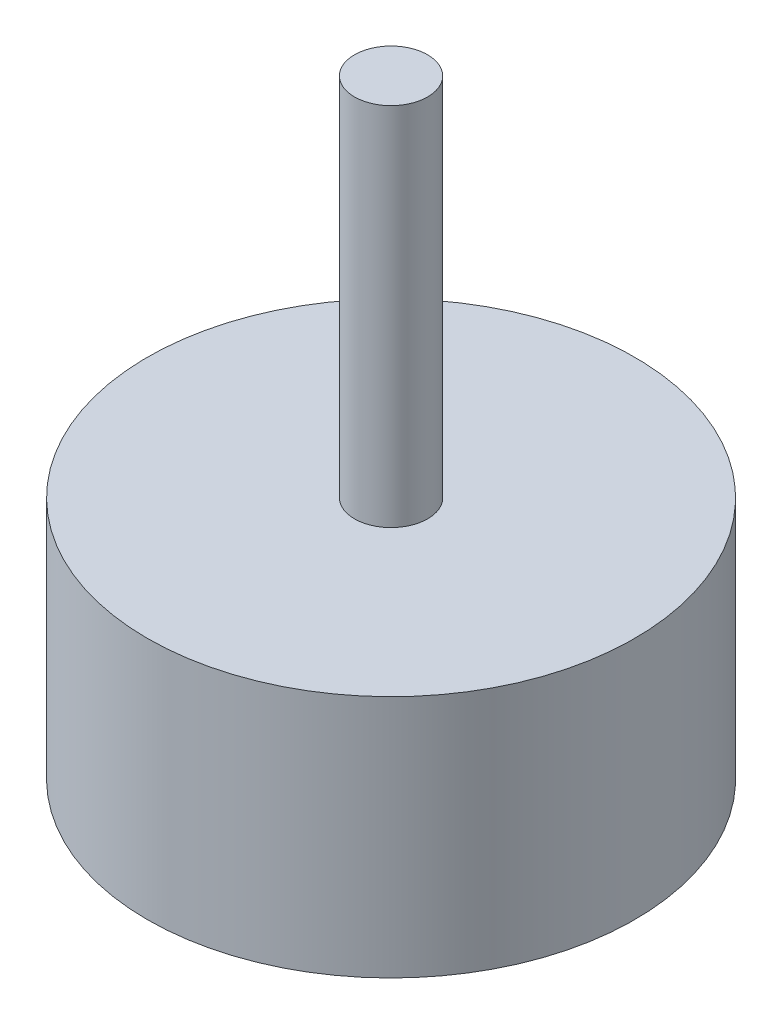
from build123d import *

# Parameters (mm, degrees)
SKETCH1_R           = 10
BOSS_EXTRUDE1_DEPTH = 10
SKETCH2_R           = 1.5
BOSS_EXTRUDE2_DEPTH = 15
CUT_EXTRUDE1_DEPTH  = 8


with BuildPart() as part:
    # Sketch1 → Boss-Extrude1 (new body)
    with BuildSketch(Plane(origin=(0, 0, 0), x_dir=(1, 0, 0), z_dir=(0, 1, 0))):
        Circle(SKETCH1_R)
    extrude(amount=BOSS_EXTRUDE1_DEPTH)

    # Sketch2 → Boss-Extrude2 (add)
    with BuildSketch(Plane(origin=(0, 10, 0), x_dir=(1, 0, 0), z_dir=(0, 1, 0))):
        Circle(SKETCH2_R)
    extrude(amount=BOSS_EXTRUDE2_DEPTH)

    # Sketch3 → Cut-Extrude1 (cut)
    with BuildSketch(Plane.XZ):
        Polygon((7, 0), (3.5, 6.062177826), (-3.5, 6.062177826), (-7, 0), (-3.5, -6.062177826), (3.5, -6.062177826), align=None)
    extrude(amount=-CUT_EXTRUDE1_DEPTH, mode=Mode.SUBTRACT)


solid = part.part
